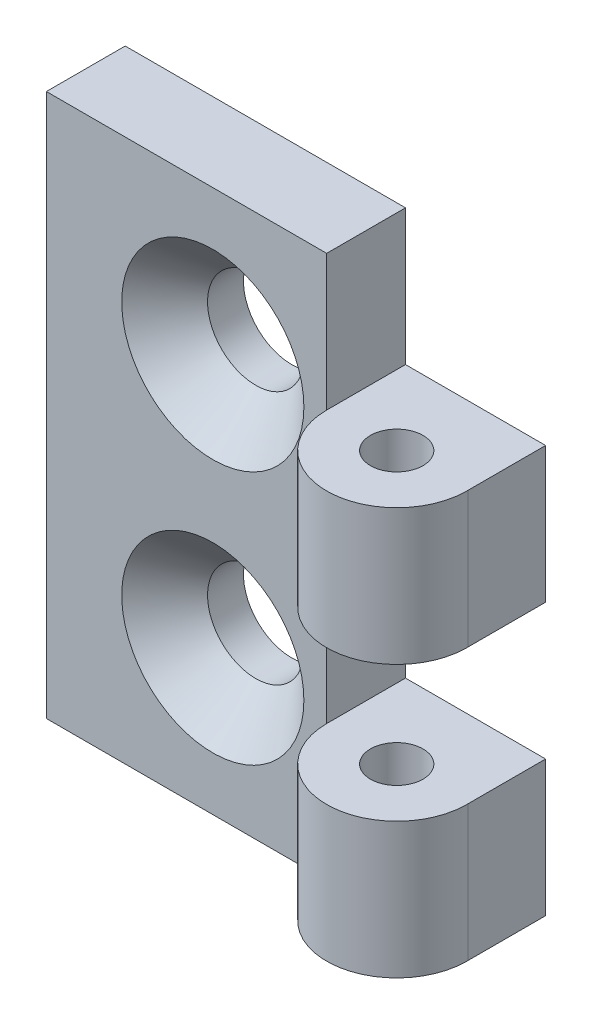
from build123d import *

# Parameters (mm, degrees)
SKETCH1_W                                      = 17
SKETCH1_H                                      = 31
BOSS_EXTRUDE1_DEPTH                            = 4.5
SKETCH2_R                                      = 4
SKETCH2_R_2                                    = 1.5
BOSS_EXTRUDE2_DEPTH                            = 7.75
FILLET2_R                                      = 15
CSK_FOR_M5_FLAT_HEAD_MACHINE_SCREW1_AT_2_COUNT = 2
CSK_FOR_M5_FLAT_HEAD_MACHINE_SCREW1_AT_2_PITCH = 14.5
BOSS_EXTRUDE4_DEPTH                            = 7.75
LPATTERN1_START                                = 15.5
LPATTERN1_OUTLINE_R                            = 1.5
LPATTERN1_DEPTH                                = 7.75
SKETCH7_W                                      = 1
SKETCH7_H                                      = 7.75
CUT_EXTRUDE1_DEPTH                             = 36.640566774


# Read off the part's stored shape, not the designer's step: LPattern1
with BuildPart() as part:
    # Sketch1 → Boss-Extrude1 (new body)
    with BuildSketch(Plane.XY):
        with Locations((-8.5, 15.5)):
            Rectangle(SKETCH1_W, SKETCH1_H)
    extrude(amount=BOSS_EXTRUDE1_DEPTH)

    # Sketch2 → Boss-Extrude2 (add)
    with BuildSketch(Plane(origin=(0, 0, 0), x_dir=(1, 0, 0), z_dir=(0, 1, 0))):
        with Locations((3, -4.5)):
            Circle(SKETCH2_R)
        with Locations(Location((3, -4.5, 0), (0, 0, 270))):
            Circle(SKETCH2_R_2, mode=Mode.SUBTRACT)
    extrude(amount=BOSS_EXTRUDE2_DEPTH)

    # Fillet2
    # the kernel refuses this fillet: 15 mm, written as the material it adds along each edge
    with BuildSketch(Plane(origin=(0, 7.75, 1.854248689), x_dir=(0.9211814219318991, 0, -0.389133380587588), z_dir=(0, -1, 0))) as fillet2_piece_1:
        with BuildLine():
            CenterArc((9.970466155, -13.517314112), FILLET2_R, 115.689791336, 12.37807292)
            Line((0.721550061, -1.708099444), (0.536571739, -1.471915151))
            ThreePointArc((0.536571739, -1.471915151), (0.084420604, -0.970789736), (-0.276354427, -0.116740014))
            Line((-0.276354427, -0.116740014), (0.130049559, 0.270346282))
            ThreePointArc((0.130049559, 0.270346282), (1.733994114, -0.095382903), (3.337938669, 0.270346282))
            Line((3.337938669, 0.270346282), (3.467988228, 0))
        make_face()
    extrude(amount=7.75)

    # Sketch4 → CSK for M5 Flat Head Machine Screw1 (revolve, cut)
    with BuildSketch(Plane(origin=(-7.5, 8.25, 4.5), x_dir=(0, -1, 0), z_dir=(1, 0, 0))):
        Polygon((0, 0), (0, 4.5), (2.75, 4.5), (2.75, 2.45), (5.2, 0), align=None)
    csk_for_m5_flat_head_machine_screw1 = revolve(axis=Axis((-7.5, 8.25, 10.85), (0, 0, -1)), mode=Mode.SUBTRACT)

    # CSK for M5 Flat Head Machine Screw1 at 2: CSK for M5 Flat Head Machine Screw1 ×2
    with Locations(*[(0, i * CSK_FOR_M5_FLAT_HEAD_MACHINE_SCREW1_AT_2_PITCH, 0) for i in range(1, CSK_FOR_M5_FLAT_HEAD_MACHINE_SCREW1_AT_2_COUNT)]):
        add(csk_for_m5_flat_head_machine_screw1, mode=Mode.SUBTRACT)

    # Sketch6 → Boss-Extrude4 (add)
    with BuildSketch(Plane.XZ):
        Polygon((0, 0), (6.999251024, 0), (6.999251024, 4.577403122), align=None)
    extrude(amount=-BOSS_EXTRUDE4_DEPTH)

    # LPattern1 outline → LPattern1 (add)
    with BuildSketch(Plane(origin=(0, 0, 0), x_dir=(1, 0, 0), z_dir=(0, 1, 0)).offset(LPATTERN1_START)):
        with BuildLine():
            Line((6.999251024, 0), (0, 0))
            Line((0, 0), (0, -4.5))
            Line((0, -4.5), (-1, -4.5))
            ThreePointArc((-1, -4.5), (3.038703373, -8.499812752), (6.999251024, -4.422596878))
            Line((6.999251024, -4.422596878), (6.999251024, 0))
        make_face()
        with Locations((3, -4.5)):
            Circle(LPATTERN1_OUTLINE_R, mode=Mode.SUBTRACT)
    extrude(amount=LPATTERN1_DEPTH)

    # Sketch7 → Cut-Extrude1 (cut, through all)
    with BuildSketch(Plane.XY.offset(4.5)):
        with Locations((-0.5, 11.625)):
            Rectangle(SKETCH7_W, SKETCH7_H)
        with Locations((-0.5, 27.125)):
            Rectangle(SKETCH7_W, SKETCH7_H)
    extrude(amount=-CUT_EXTRUDE1_DEPTH, mode=Mode.SUBTRACT)


solid = part.part
